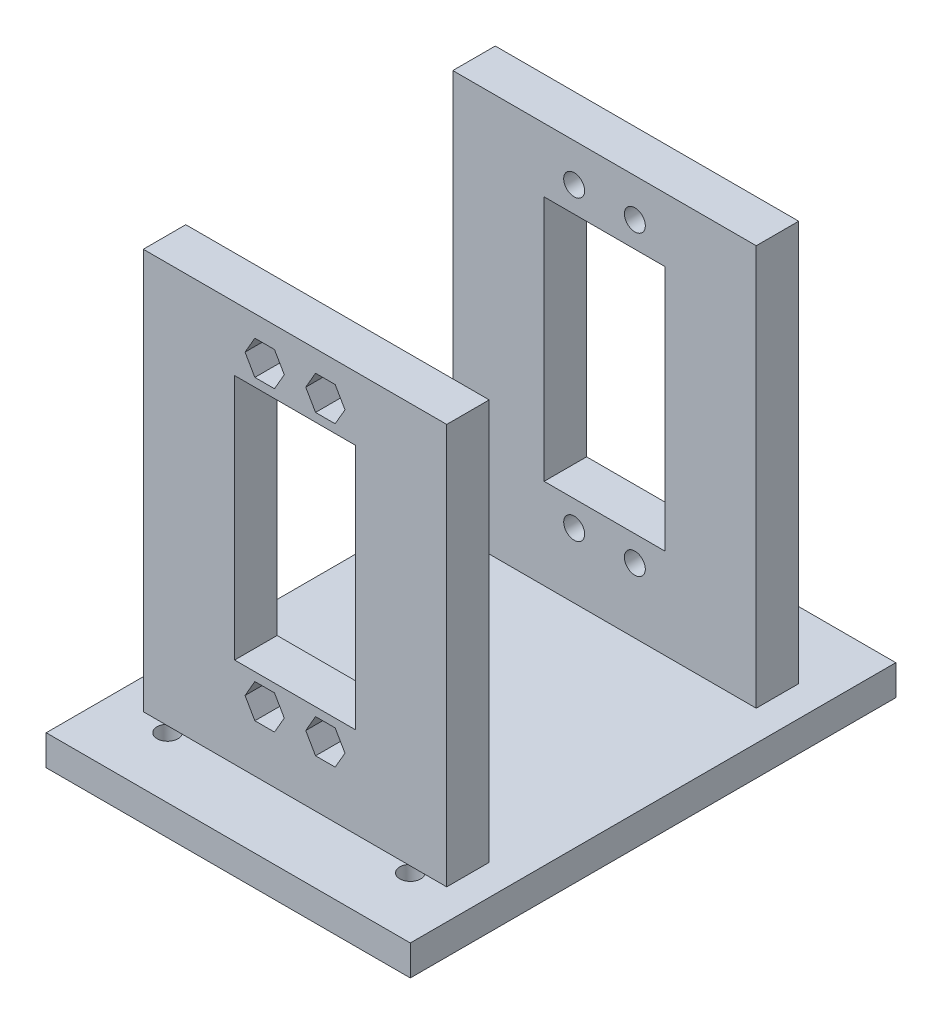
from build123d import *

# Parameters (mm, degrees)
SKETCH1_W           = 60
SKETCH1_H           = 80
BOSS_EXTRUDE1_DEPTH = 2.5
SKETCH2_R           = 1.725
CUT_EXTRUDE1_DEPTH  = 51.249378106
SKETCH3_W           = 50
SKETCH3_H           = 66
BOSS_EXTRUDE2_DEPTH = 7
SKETCH4_W           = 19.9
SKETCH4_H           = 40.6
CUT_EXTRUDE2_DEPTH  = 102.750921372
SKETCH5_R           = 1.725
CUT_EXTRUDE3_DEPTH  = 102.750921372
CUT_EXTRUDE4_DEPTH  = 4.2


with BuildPart() as part:
    # Sketch1 → Boss-Extrude1 (new, symmetric)
    with BuildSketch(Plane(origin=(0, 0, 0), x_dir=(1, 0, 0), z_dir=(0, 1, 0))):
        Rectangle(SKETCH1_W, SKETCH1_H)
    extrude(amount=BOSS_EXTRUDE1_DEPTH, both=True)

    # Sketch2 → Cut-Extrude1 (cut, through all)
    with BuildSketch(Plane(origin=(0, 2.5, 0), x_dir=(1, 0, 0), z_dir=(0, 1, 0))):
        with Locations((-20, 30)):
            Circle(SKETCH2_R)
        with Locations((20, 30)):
            Circle(SKETCH2_R)
        with Locations((20, -30)):
            Circle(SKETCH2_R)
        with Locations((-20, -30)):
            Circle(SKETCH2_R)
    extrude(amount=-CUT_EXTRUDE1_DEPTH, mode=Mode.SUBTRACT)

    # Sketch3 → Boss-Extrude2 (add)
    with BuildSketch(Plane.XY.offset(22)):
        with Locations((0, 35.5)):
            Rectangle(SKETCH3_W, SKETCH3_H)
    boss_extrude2 = extrude(amount=BOSS_EXTRUDE2_DEPTH)

    # Mirror1: Boss-Extrude2 across plane
    add(boss_extrude2.mirror(Plane.XY))

    # Sketch4 → Cut-Extrude2 (cut, through all)
    with BuildSketch(Plane.XY.offset(29)):
        with Locations((0, 37.7)):
            Rectangle(SKETCH4_W, SKETCH4_H)
    extrude(amount=-CUT_EXTRUDE2_DEPTH, mode=Mode.SUBTRACT)

    # Sketch5 → Cut-Extrude3 (cut, through all)
    with BuildSketch(Plane.XY.offset(29)):
        with Locations((-5, 62.2)):
            Circle(SKETCH5_R)
        with Locations((5, 62.2)):
            Circle(SKETCH5_R)
        with Locations((-5, 13.2)):
            Circle(SKETCH5_R)
        with Locations((5, 13.2)):
            Circle(SKETCH5_R)
    extrude(amount=-CUT_EXTRUDE3_DEPTH, mode=Mode.SUBTRACT)

    # Sketch6 → Cut-Extrude4 (cut)
    with BuildSketch(Plane.XY.offset(29)):
        Polygon((-1.766838493, 62.2), (-3.383419246, 65), (-6.616580754, 65), (-8.233161507, 62.2), (-6.616580754, 59.4), (-3.383419246, 59.4), align=None)
        Polygon((1.766838493, 62.2), (3.383419246, 59.4), (6.616580754, 59.4), (8.233161507, 62.2), (6.616580754, 65), (3.383419246, 65), align=None)
        Polygon((-1.766838493, 13.2), (-3.383419246, 16), (-6.616580754, 16), (-8.233161507, 13.2), (-6.616580754, 10.4), (-3.383419246, 10.4), align=None)
        Polygon((8.233161507, 13.2), (6.616580754, 16), (3.383419246, 16), (1.766838493, 13.2), (3.383419246, 10.4), (6.616580754, 10.4), align=None)
    cut_extrude4 = extrude(amount=-CUT_EXTRUDE4_DEPTH, mode=Mode.SUBTRACT)

    # Mirror3: Cut-Extrude4 across plane
    add(cut_extrude4.mirror(Plane.XY), mode=Mode.SUBTRACT)


solid = part.part
